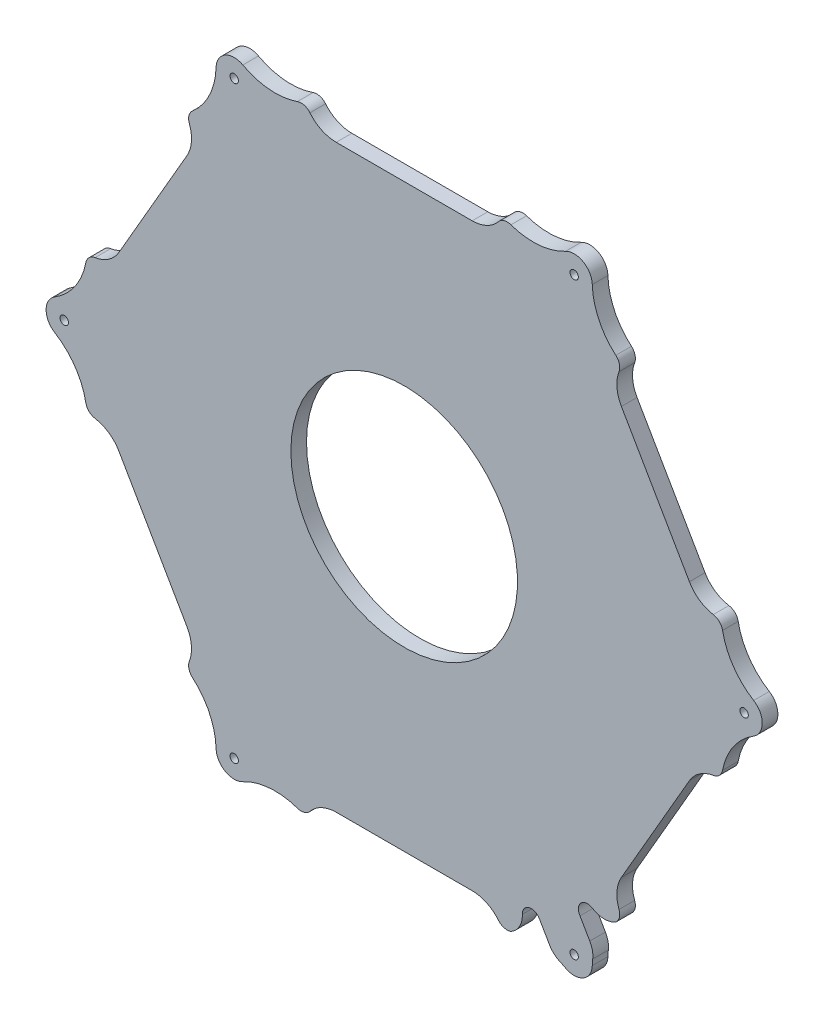
from build123d import *

# Parameters (mm, degrees)
SKETCH1_R                = 143
SKETCH1_R_2              = 50
BOSS_EXTRUDE1_DEPTH      = 6.9
SKETCH2_R                = 1.85
BOSS_EXTRUDE2_DEPTH      = 6.9
FILLET1_R                = 30
CIRPATTERN1_COUNT        = 6
FILLET1_OF_CIRPATTERN1_R = 30
CUT_EXTRUDE1_DEPTH       = 214.214938645
FILLET3_R                = 5
CIRPATTERN2_COUNT        = 6
FILLET3_OF_CIRPATTERN2_R = 5
CUT_EXTRUDE2_DEPTH       = 10
FILLET4_R                = 10
FILLET5_START            = -1
FILLET5_DEPTH            = 9


with BuildPart() as part:
    # Sketch1 → Boss-Extrude1 (new body)
    with BuildSketch(Plane.XY):
        with Locations(Location((0, 0, 0), (0, 0, 180))):
            Circle(SKETCH1_R)
        with Locations(Location((0, 0, 0), (0, 0, 180))):
            Circle(SKETCH1_R_2, mode=Mode.SUBTRACT)
    extrude(amount=BOSS_EXTRUDE1_DEPTH)

    # Sketch2 → Boss-Extrude2 (add)
    with BuildSketch(Plane.XY.offset(6.9)):
        with BuildLine():
            Line((-136, -8), (-150, -8))
            ThreePointArc((-150, -8), (-158, 0), (-150, 8))
            Line((-150, 8), (-136, 8))
            ThreePointArc((-136, 8), (-128, 0), (-136, -8))
        make_face()
        with Locations((-150, 0)):
            Circle(SKETCH2_R, mode=Mode.SUBTRACT)
    boss_extrude2 = extrude(amount=-BOSS_EXTRUDE2_DEPTH)

    # Fillet1
    fillet1_edges = [part.edges().sort_by_distance(p)[0] for p in [
        (-142.776048411, 8, 3.45),
        (-142.776048411, -8, 3.45),
    ]]
    fillet(fillet1_edges, radius=FILLET1_R)

    # CirPattern1: Boss-Extrude2 ×6 about axis
    cirpattern1_axis = Axis((0, 0, 0), (0, 0, 1))
    for i in range(1, CIRPATTERN1_COUNT):
        add(boss_extrude2.rotate(cirpattern1_axis, i * 360 / CIRPATTERN1_COUNT))

    # Fillet1 of CirPattern1
    fillet1_of_cirpattern1_edges = [part.edges().sort_by_distance(p)[0] for p in [
        (-78.316227436, -119.647684976, 3.45),
        (-64.459820975, -127.647684976, 3.45),
        (64.459820975, -127.647684976, 3.45),
        (78.316227436, -119.647684976, 3.45),
        (142.776048411, -8, 3.45),
        (142.776048411, 8, 3.45),
        (78.316227436, 119.647684976, 3.45),
        (64.459820975, 127.647684976, 3.45),
        (-64.459820975, 127.647684976, 3.45),
        (-78.316227436, 119.647684976, 3.45),
    ]]
    fillet(fillet1_of_cirpattern1_edges, radius=FILLET1_OF_CIRPATTERN1_R)

    # Sketch7 → Cut-Extrude1 (cut, through all)
    with BuildSketch(Plane.XY.offset(6.9)):
        with BuildLine():
            Line((-30, 158), (30, 158))
            ThreePointArc((30, 158), (45, 143), (30, 128))
            Line((30, 128), (-30, 128))
            ThreePointArc((-30, 128), (-45, 143), (-30, 158))
        make_face()
    cut_extrude1 = extrude(amount=-CUT_EXTRUDE1_DEPTH, mode=Mode.SUBTRACT)

    # Fillet3
    fillet3_edges = [part.edges().sort_by_distance(p)[0] for p in [
        (43.398254251, 136.255610996, 3.45),
        (-43.398254251, 136.255610996, 3.45),
    ]]
    fillet(fillet3_edges, radius=FILLET3_R)

    # CirPattern2: Cut-Extrude1 ×6 about axis
    cirpattern2_axis = Axis((0, 0, 0), (0, 0, 1))
    for i in range(1, CIRPATTERN2_COUNT):
        add(cut_extrude1.rotate(cirpattern2_axis, i * 360 / CIRPATTERN2_COUNT), mode=Mode.SUBTRACT)

    # Fillet3 of CirPattern2
    fillet3_of_cirpattern2_edges = [part.edges().sort_by_distance(p)[0] for p in [
        (-96.301693406, 105.711796159, 3.45),
        (-139.699947656, 30.543814837, 3.45),
        (-139.699947656, -30.543814837, 3.45),
        (-96.301693406, -105.711796159, 3.45),
        (-43.398254251, -136.255610996, 3.45),
        (43.398254251, -136.255610996, 3.45),
        (96.301693406, -105.711796159, 3.45),
        (139.699947656, -30.543814837, 3.45),
        (139.699947656, 30.543814837, 3.45),
        (96.301693406, 105.711796159, 3.45),
    ]]
    fillet(fillet3_of_cirpattern2_edges, radius=FILLET3_OF_CIRPATTERN2_R)

    # Sketch8 → Cut-Extrude2 (cut)
    with BuildSketch(Plane.XY.offset(6.9)):
        with BuildLine():
            Line((88.826969439, -117.302003887), (84.326969439, -109.507775253))
            ThreePointArc((84.326969439, -109.507775253), (78.727650946, -108.125342861), (77.567379868, -113.774878941))
            Line((77.567379868, -113.774878941), (81.895896581, -121.29702529))
            ThreePointArc((81.895896581, -121.29702529), (87.360379041, -122.76754121), (88.826969439, -117.302003887))
        make_face()
        with BuildLine():
            Line((64.101233792, -131.577414018), (59.601233792, -123.783185384))
            ThreePointArc((59.601233792, -123.783185384), (54.136918717, -122.319207019), (52.673277073, -127.783612295))
            Line((52.673277073, -127.783612295), (57.221343973, -135.658853653))
            ThreePointArc((57.221343973, -135.658853653), (62.677994964, -137.017599926), (64.101233792, -131.577414018))
        make_face()
    extrude(amount=-CUT_EXTRUDE2_DEPTH, mode=Mode.SUBTRACT)

    # Fillet4
    fillet4_edges = [part.edges().sort_by_distance(p)[0] for p in [
        (64.565608345, -134.330457838, 3.45),
        (84.050784817, -123.080685956, 3.45),
    ]]
    fillet(fillet4_edges, radius=FILLET4_R)

    # Fillet5: read off the stored shape, not the designer's step
    # Fillet5 outline → Fillet5 (cut)
    with BuildSketch(Plane.XY.offset(FILLET5_START)):
        with BuildLine():
            ThreePointArc((87.553061033, -115.095529803), (90.213766815, -111.477504252), (93.384762884, -108.297213687))
            ThreePointArc((93.384762884, -108.297213687), (88.166794559, -109.665787745), (82.997135719, -108.124743986))
            ThreePointArc((82.997135719, -108.124743986), (83.746204288, -108.73534476), (84.326969439, -109.507775253))
            Line((84.326969439, -109.507775253), (87.553061033, -115.095529803))
        make_face()
        with BuildLine():
            ThreePointArc((52.14020721, -125.939999968), (50.889960833, -131.187577731), (47.09575677, -135.022183827))
            ThreePointArc((47.09575677, -135.022183827), (51.435909668, -133.866082974), (55.900021902, -133.370907928))
            Line((55.900021902, -133.370907928), (52.673277073, -127.783612295))
            ThreePointArc((52.673277073, -127.783612295), (52.294537166, -126.894249553), (52.14020721, -125.939999968))
        make_face()
    extrude(amount=FILLET5_DEPTH, mode=Mode.SUBTRACT)


solid = part.part
